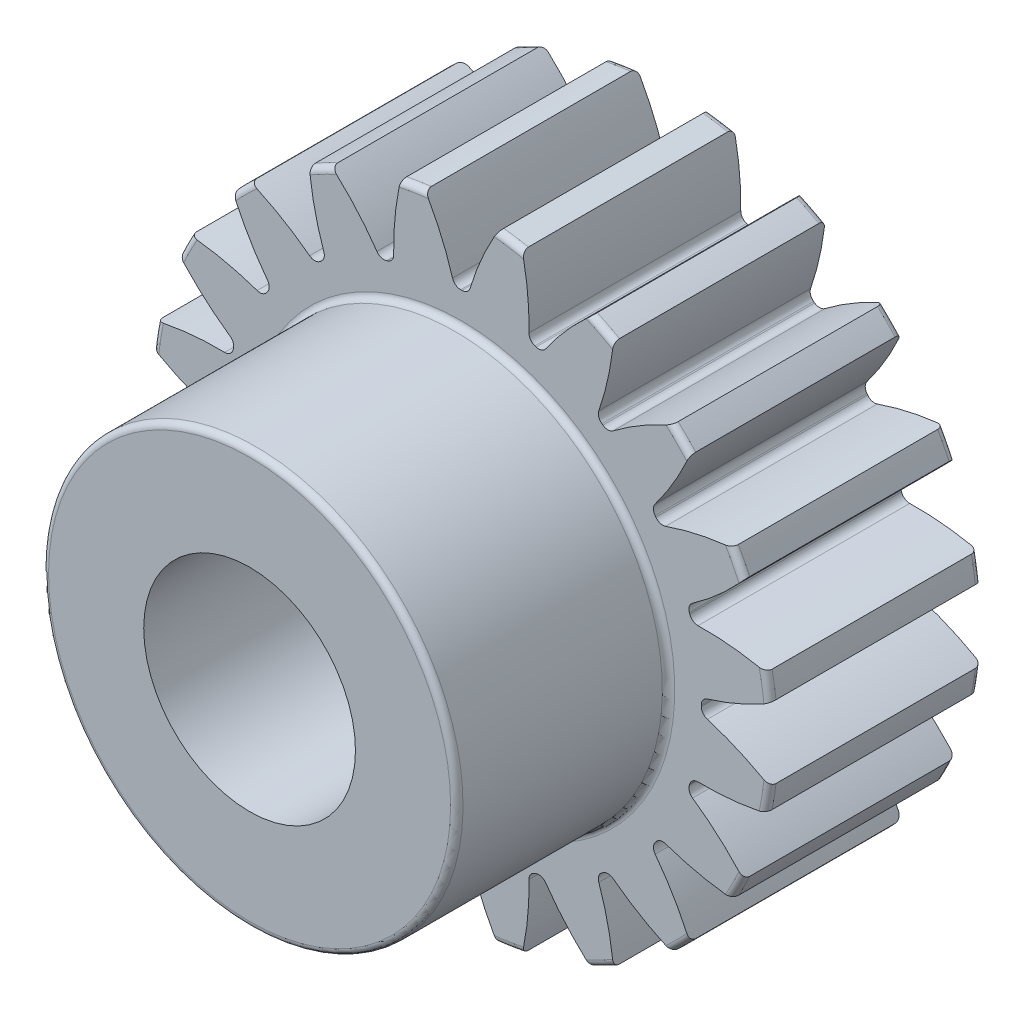
from build123d import *

# Parameters (mm, degrees)
FILLET2_R          = 0.2794
CUT_EXTRUDE2_DEPTH = 22.932793497
CIRPATTERN1_COUNT  = 20


with BuildPart() as part:
    # Sketch4 → Revolve1 (revolve)
    with BuildSketch(Plane(origin=(0, 0, 0), x_dir=(0, 0, -1), z_dir=(1, 0, 0))):
        Polygon((-19.05, 4.7625), (-19.05, 9.3218), (-9.525, 9.3218), (-9.525, 13.97), (0, 13.97), (0, 4.7625), align=None)
    revolve(axis=Axis((0, 0, 9.525), (0, 0, 1)))

    # Fillet2
    fillet2_edges = [part.edges().sort_by_distance(p)[0] for p in [
        (0, -9.3218, 19.05),
        (0, -9.3218, 9.525),
        (0, -13.97, 9.525),
        (0, -13.97, 0),
    ]]
    fillet(fillet2_edges, radius=FILLET2_R)

    # Sketch7 → Cut-Extrude2 (cut, through all)
    with BuildSketch(Plane.XY.offset(9.525)):
        with BuildLine():
            ThreePointArc((-0.029449487, 10.79495983), (0, 10.795), (0.029449487, 10.79495983))
            ThreePointArc((0.029449487, 10.79495983), (0.257238629, 10.869772623), (0.395246272, 11.06583062))
            ThreePointArc((0.395246272, 11.06583062), (0.92781573, 12.507614405), (1.630655191, 13.874504087))
            ThreePointArc((1.630655191, 13.874504087), (0, 13.97), (-1.630655191, 13.874504087))
            ThreePointArc((-1.630655191, 13.874504087), (-0.92781573, 12.507614405), (-0.395246272, 11.06583062))
            ThreePointArc((-0.395246272, 11.06583062), (-0.257238629, 10.869772623), (-0.029449487, 10.79495983))
        make_face()
    cut_extrude2 = extrude(amount=-CUT_EXTRUDE2_DEPTH, mode=Mode.SUBTRACT)

    # CirPattern1: Cut-Extrude2 ×20 about axis
    cirpattern1_axis = Axis((0, 0, 19.05), (0, 0, -1))
    for i in range(1, CIRPATTERN1_COUNT):
        add(cut_extrude2.rotate(cirpattern1_axis, i * 360 / CIRPATTERN1_COUNT), mode=Mode.SUBTRACT)


solid = part.part
